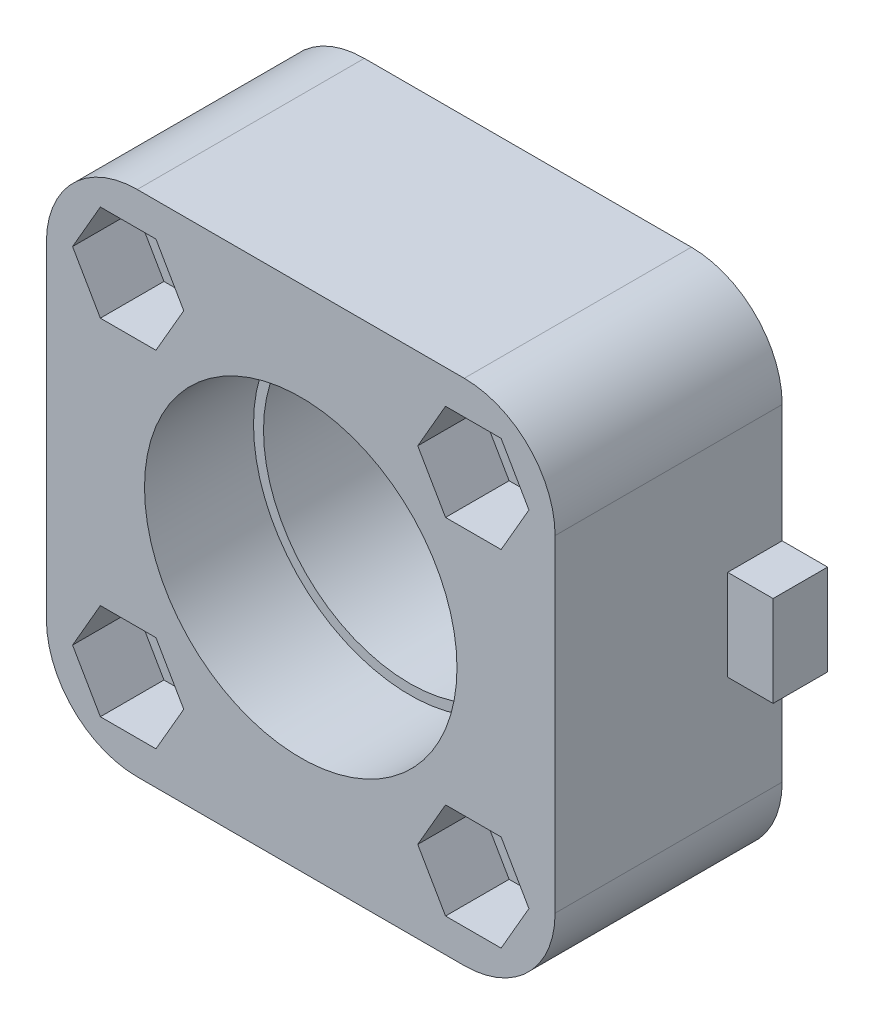
from build123d import *

# Parameters (mm, degrees)
CROQUIS1_W              = 28
CROQUIS1_H              = 28
CROQUIS1_R              = 8.05
SALIENTE_EXTRUIR1_DEPTH = 3.25
CROQUIS2_W              = 28
CROQUIS2_H              = 28
CROQUIS2_R              = 8.6
SALIENTE_EXTRUIR2_DEPTH = 6
CORTAR_EXTRUIR1_DEPTH   = 3.5
CROQUIS6_R              = 1.5
CORTAR_EXTRUIR2_DEPTH   = 23.5
CROQUIS7_W              = 10
CROQUIS7_H              = 3.5
CROQUIS7_W_2            = 2.5
CROQUIS7_H_2            = 5
SALIENTE_EXTRUIR3_DEPTH = 3
REDONDEO1_R             = 5


with BuildPart() as part:
    # Croquis1 → Saliente-Extruir1 (new, symmetric)
    with BuildSketch(Plane.XY):
        Rectangle(CROQUIS1_W, CROQUIS1_H)
        Circle(CROQUIS1_R, mode=Mode.SUBTRACT)
    extrude(amount=SALIENTE_EXTRUIR1_DEPTH, both=True)

    # Croquis2 → Saliente-Extruir2 (add)
    with BuildSketch(Plane.XY.offset(3.25)):
        Rectangle(CROQUIS2_W, CROQUIS2_H)
        Circle(CROQUIS2_R, mode=Mode.SUBTRACT)
    extrude(amount=SALIENTE_EXTRUIR2_DEPTH)

    # Croquis3 → Cortar-Extruir1 (cut)
    with BuildSketch(Plane.XY.offset(9.25)):
        Polygon((11.029978213, 12.15), (7.970021787, 12.15), (6.440043573, 9.5), (7.970021787, 6.85), (11.029978213, 6.85), (12.559956427, 9.5), align=None)
        Polygon((-6.440043573, 9.5), (-7.970021787, 12.15), (-11.029978213, 12.15), (-12.559956427, 9.5), (-11.029978213, 6.85), (-7.970021787, 6.85), align=None)
        Polygon((-7.970021787, -6.85), (-11.029978213, -6.85), (-12.559956427, -9.5), (-11.029978213, -12.15), (-7.970021787, -12.15), (-6.440043573, -9.5), align=None)
        Polygon((11.029978213, -6.85), (7.970021787, -6.85), (6.440043573, -9.5), (7.970021787, -12.15), (11.029978213, -12.15), (12.559956427, -9.5), align=None)
    extrude(amount=-CORTAR_EXTRUIR1_DEPTH, mode=Mode.SUBTRACT)

    # Croquis6 → Cortar-Extruir2 (cut)
    with BuildSketch(Plane(origin=(0, 0, -3.25), x_dir=(-1, 0, 0), z_dir=(0, 0, -1))):
        with Locations((-9.5, 9.5)):
            Circle(CROQUIS6_R)
        with Locations((9.5, 9.5)):
            Circle(CROQUIS6_R)
        with Locations((9.5, -9.5)):
            Circle(CROQUIS6_R)
        with Locations((-9.5, -9.5)):
            Circle(CROQUIS6_R)
    extrude(amount=-CORTAR_EXTRUIR2_DEPTH, mode=Mode.SUBTRACT)

    # Croquis7 → Saliente-Extruir3 (add)
    with BuildSketch(Plane(origin=(0, 0, -3.25), x_dir=(-1, 0, 0), z_dir=(0, 0, -1))):
        Polygon((14, -5.5), (18.9, -5.5), (18.9, -2.5), (16.5, -2.5), (16.5, 2.5), (18.9, 2.5), (18.9, 5.5), (14, 5.5), align=None)
        with Locations((0, -15.75)):
            Rectangle(CROQUIS7_W, CROQUIS7_H)
        with Locations((-15.25, 0)):
            Rectangle(CROQUIS7_W_2, CROQUIS7_H_2)
    extrude(amount=-SALIENTE_EXTRUIR3_DEPTH)

    # Redondeo1
    redondeo1_edges = [part.edges().sort_by_distance(p)[0] for p in [
        (-14, 14, 3),
        (-14, -14, 3),
        (14, -14, 3),
        (14, 14, 3),
    ]]
    fillet(redondeo1_edges, radius=REDONDEO1_R)


solid = part.part
